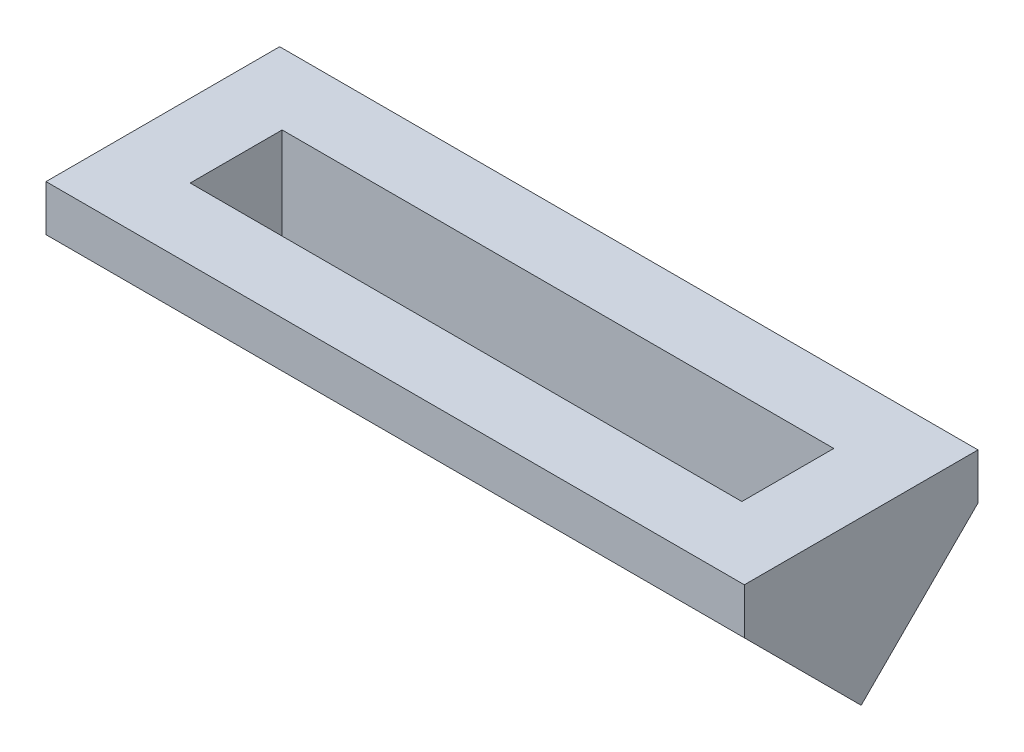
from build123d import *

# Parameters (mm, degrees)
SKETCH1_W           = 192.921126566
SKETCH1_H           = 64.543351392
SKETCH1_W_2         = 152.4
SKETCH1_H_2         = 25.4
BOSS_EXTRUDE4_DEPTH = 50.8
CHAMFER2_SIZE       = 38.1
SKETCH1_5_W         = 152.4
SKETCH1_5_H         = 25.4
CUT_EXTRUDE1_DEPTH  = 35.56


with BuildPart() as part:
    # Sketch1 → Boss-Extrude4 (new body)
    # profile 1 of 2: a face of its own
    with BuildSketch(Plane(origin=(0, 0, 0), x_dir=(1, 0, 0), z_dir=(0, 1, 0))):
        Rectangle(SKETCH1_W, SKETCH1_H)
        Rectangle(SKETCH1_W_2, SKETCH1_H_2, mode=Mode.SUBTRACT)
    # profile 2 of 2: a face of its own
    with BuildSketch(Plane(origin=(0, 0, 0), x_dir=(1, 0, 0), z_dir=(0, 1, 0))):
        Rectangle(SKETCH1_W_2, SKETCH1_H_2)
    extrude(amount=-BOSS_EXTRUDE4_DEPTH)

    # Chamfer2
    # the kernel refuses this chamfer: 38.1 mm, written as the material it takes off along each edge
    with BuildSketch(Plane(origin=(-194.441685124, -50.8, 32.271675696), x_dir=(0, 0.9996219169112968, 0.02749587661058638), z_dir=(1, 0, 0))) as chamfer2_piece_1:
        Polygon((CHAMFER2_SIZE * 0.999621916911, -CHAMFER2_SIZE * 0.0274958766106), (-CHAMFER2_SIZE * 0.0274958766106, -CHAMFER2_SIZE * 0.999621916911), (0, 0), align=None)
    extrude(amount=388.883370249, mode=Mode.SUBTRACT)
    with BuildSketch(Plane(origin=(194.441685124, -50.8, -32.271675696), x_dir=(0, -0.02749587661058638, 0.9996219169112968), z_dir=(-1, 0, 0))) as chamfer2_piece_2:
        Polygon((CHAMFER2_SIZE * 0.999621916911, CHAMFER2_SIZE * 0.0274958766106), (-CHAMFER2_SIZE * 0.0274958766106, CHAMFER2_SIZE * 0.999621916911), (0, 0), align=None)
    extrude(amount=388.883370249, mode=Mode.SUBTRACT)

    # Sketch1<5> → Cut-Extrude1 (cut)
    with BuildSketch(Plane(origin=(0, 0, 0), x_dir=(1, 0, 0), z_dir=(0, 1, 0))):
        Rectangle(SKETCH1_5_W, SKETCH1_5_H)
    extrude(amount=-CUT_EXTRUDE1_DEPTH, mode=Mode.SUBTRACT)


solid = part.part
